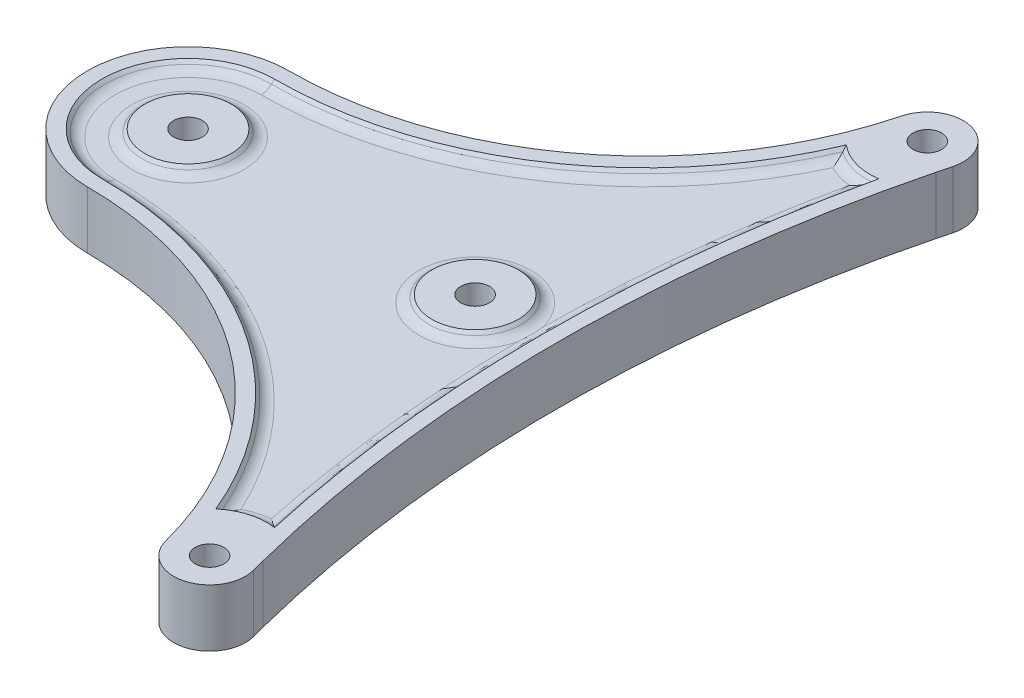
from build123d import *

# Parameters (mm, degrees)
BOSS_EXTRUDE1_DEPTH     = 4
SKETCH2_R               = 2
CUT_EXTRUDE1_DEPTH      = 58.567351858
SKETCH4_R               = 2
CUT_EXTRUDE2_DEPTH      = 58.567351858
BOSS_EXTRUDE2_DEPTH     = 4
SKETCH7_R               = 2
CUT_EXTRUDE3_DEPTH      = 85.777889694
BOSS_EXTRUDE3_DEPTH     = 4
SKETCH9_R               = 6
CUT_EXTRUDE4_DEPTH      = 1
CUT_EXTRUDE4_DRAFT      = -45
FILLET5_R               = 2
MIRROR2_COPY_1_SKETCH_R = 6
MIRROR2_COPY_1_DEPTH    = 1
MIRROR2_COPY_1_DRAFT    = -45
FILLET5_OF_MIRROR2_R    = 2


with BuildPart() as part:
    # Sketch1 → Boss-Extrude1 (new, symmetric)
    with BuildSketch(Plane(origin=(0, 0, 0), x_dir=(1, 0, 0), z_dir=(0, 1, 0))):
        with BuildLine():
            Line((-14.839112534, -1.258169259), (-1.839112534, -51.258169259))
            ThreePointArc((-1.839112534, -51.258169259), (4.258169259, -54.839112534), (7.839112534, -48.741830741))
            Line((7.839112534, -48.741830741), (-4.833763459, 0))
            Line((-4.833763459, 0), (-5.160887466, -1.258169259))
            ThreePointArc((-5.160887466, -1.258169259), (-10, -5), (-14.839112534, -1.258169259))
        make_face()
        with BuildLine():
            ThreePointArc((-14.839112534, 1.258169259), (-15, 0), (-14.839112534, -1.258169259))
            ThreePointArc((-14.839112534, -1.258169259), (-10, -5), (-5.160887466, -1.258169259))
            Line((-5.160887466, -1.258169259), (-4.833763459, 0))
            Line((-4.833763459, 0), (-5.160887466, 1.258169259))
            ThreePointArc((-5.160887466, 1.258169259), (-10, 5), (-14.839112534, 1.258169259))
        make_face()
        with BuildLine():
            Line((-1.839112534, 51.258169259), (-14.839112534, 1.258169259))
            ThreePointArc((-14.839112534, 1.258169259), (-10, 5), (-5.160887466, 1.258169259))
            Line((-5.160887466, 1.258169259), (-4.833763459, 0))
            Line((-4.833763459, 0), (7.839112534, 48.741830741))
            ThreePointArc((7.839112534, 48.741830741), (4.258169259, 54.839112534), (-1.839112534, 51.258169259))
        make_face()
    extrude(amount=BOSS_EXTRUDE1_DEPTH, both=True)

    # Sketch2 → Cut-Extrude1 (cut, through all)
    with BuildSketch(Plane(origin=(0, 4, 0), x_dir=(1, 0, 0), z_dir=(0, 1, 0))):
        with Locations(Location((-10, 0, 0), (0, 0, 270))):
            Circle(SKETCH2_R)
    extrude(amount=-CUT_EXTRUDE1_DEPTH, mode=Mode.SUBTRACT)

    # Sketch4 → Cut-Extrude2 (cut, through all)
    with BuildSketch(Plane(origin=(0, 4, 0), x_dir=(1, 0, 0), z_dir=(0, 1, 0))):
        with Locations(Location((3, -50, 0), (0, 0, 270))):
            Circle(SKETCH4_R)
        with Locations(Location((3, 50, 0), (0, 0, 270))):
            Circle(SKETCH4_R)
    extrude(amount=-CUT_EXTRUDE2_DEPTH, mode=Mode.SUBTRACT)

    # Sketch6 → Boss-Extrude2 (add, symmetric)
    with BuildSketch(Plane(origin=(0, 0, 0), x_dir=(1, 0, 0), z_dir=(0, 1, 0))):
        with BuildLine():
            Line((-1.839112534, -51.258169259), (-14.839112534, -1.258169259))
            ThreePointArc((-14.839112534, -1.258169259), (-15, 0), (-14.839112534, 1.258169259))
            Line((-14.839112534, 1.258169259), (-1.839112534, 51.258169259))
            ThreePointArc((-1.839112534, 51.258169259), (-19.560267402, 24.413897754), (-50, 14.017892663))
            ThreePointArc((-50, 14.017892663), (-64.017892663, 0), (-50, -14.017892663))
            ThreePointArc((-50, -14.017892663), (-19.560267402, -24.413897754), (-1.839112534, -51.258169259))
        make_face()
    extrude(amount=BOSS_EXTRUDE2_DEPTH, both=True)

    # Sketch7 → Cut-Extrude3 (cut, through all)
    with BuildSketch(Plane(origin=(0, 4, 0), x_dir=(1, 0, 0), z_dir=(0, 1, 0))):
        with Locations(Location((-50, 0, 0), (0, 0, 270))):
            Circle(SKETCH7_R)
    extrude(amount=-CUT_EXTRUDE3_DEPTH, mode=Mode.SUBTRACT)

    # Sketch8 → Boss-Extrude3 (add, symmetric)
    with BuildSketch(Plane(origin=(0, 0, 0), x_dir=(1, 0, 0), z_dir=(0, 1, 0))):
        with BuildLine():
            ThreePointArc((7.35446577, -46.877804725), (1.480703509, 0), (7.35446577, 46.877804725))
            Line((7.35446577, 46.877804725), (-4.833763459, 0))
            Line((-4.833763459, 0), (7.35446577, -46.877804725))
        make_face()
    extrude(amount=BOSS_EXTRUDE3_DEPTH, both=True)


with BuildPart() as cut_extrude4_tool:
    # Sketch9 → Cut-Extrude4 (with draft: the straight prism first)
    with BuildSketch(Plane(origin=(0, 4, 0), x_dir=(1, 0, 0), z_dir=(0, 1, 0))):
        with BuildLine():
            ThreePointArc((-2.199405253, -43.920017679), (0.776418175, -42.315230396), (4.149389552, -42.082999074))
            ThreePointArc((4.149389552, -42.082999074), (-0.519296491, 0), (4.149389552, 42.082999074))
            ThreePointArc((4.149389552, 42.082999074), (0.776418175, 42.315230396), (-2.199405253, 43.920017679))
            ThreePointArc((-2.199405253, 43.920017679), (-21.26568933, 20.725904419), (-50, 12.017892663))
            ThreePointArc((-50, 12.017892663), (-62.017892663, 0), (-50, -12.017892663))
            ThreePointArc((-50, -12.017892663), (-21.26568933, -20.725904419), (-2.199405253, -43.920017679))
        make_face()
        with Locations((-10, 0)):
            Circle(SKETCH9_R, mode=Mode.SUBTRACT)
        with Locations((-50, 0)):
            Circle(SKETCH9_R, mode=Mode.SUBTRACT)
    extrude(amount=-CUT_EXTRUDE4_DEPTH)
    # Cut-Extrude4: the draft: its side faces are tilted about the plane it starts from
    cut_extrude4_sides = [cut_extrude4_tool.faces().sort_by_distance(p)[0] for p in [
        (0.776418175, 3.5, 42.315230396),
        (-0.519296491, 3.5, 0),
        (0.776418175, 3.5, -42.315230396),
        (-21.26568933, 3.5, -20.725904419),
        (-62.017892663, 3.5, 0),
        (-21.26568933, 3.5, 20.725904419),
        (-16, 3.5, 0),
        (-56, 3.5, 0),
    ]]
    draft(cut_extrude4_sides, Plane(origin=(0, 4, 0), x_dir=(1, 0, 0), z_dir=(0, 1, 0)), CUT_EXTRUDE4_DRAFT)


with BuildPart() as part_1:
    add(part.part)

    # Cut-Extrude4: cut by cut_extrude4_tool
    add(cut_extrude4_tool.part, mode=Mode.SUBTRACT)

    # Fillet5
    # the kernel refuses this fillet: 2 mm, written as the material it adds along each edge
    with BuildSketch(Plane(origin=(-50, 3, 0), x_dir=(1, 0, 0), z_dir=(0, 0, 1))) as fillet5_piece_1:
        with BuildLine():
            CenterArc((7 + FILLET5_R * 0.414213562373, FILLET5_R), FILLET5_R, 225, 45)
            Line((7 - FILLET5_R * 0.292893218813, FILLET5_R * 0.292893218813), (7, 0))
            Line((7, 0), (7 + FILLET5_R * 0.414213562373, 0))
        make_face()
    fillet5_piece_1_solid = revolve(axis=Axis((-50, 3, 0), (0, 1, 0)), mode=Mode.PRIVATE)
    with BuildSketch(Plane(origin=(-10, 3, 0), x_dir=(1, 0, 0), z_dir=(0, 0, 1))) as fillet5_piece_2:
        with BuildLine():
            CenterArc((7 + FILLET5_R * 0.414213562373, FILLET5_R), FILLET5_R, 225, 45)
            Line((7 - FILLET5_R * 0.292893218813, FILLET5_R * 0.292893218813), (7, 0))
            Line((7, 0), (7 + FILLET5_R * 0.414213562373, 0))
        make_face()
    fillet5_piece_2_solid = revolve(axis=Axis((-10, 3, 0), (0, 1, 0)), mode=Mode.PRIVATE)
    with BuildSketch(Plane(origin=(-50, 3, 0), x_dir=(0, 0, -1), z_dir=(1, 0, 0))) as fillet5_piece_3:
        with BuildLine():
            CenterArc((11.017892663 - FILLET5_R * 0.414213562373, FILLET5_R), FILLET5_R, 270, 45)
            Line((11.017892663 - FILLET5_R * 0.414213562373, 0), (11.017892663, 0))
            Line((11.017892663, 0), (11.017892663 + FILLET5_R * 0.292893218813, FILLET5_R * 0.292893218813))
        make_face()
    fillet5_piece_3_solid = revolve(axis=Axis((-50, 3, 0), (0, 1, 0)), revolution_arc=180, mode=Mode.PRIVATE)
    with BuildSketch(Plane(origin=(-50, 3, -63.78), x_dir=(0.9292070128080167, 0, 0.369559639771989), z_dir=(0.369559639771989, 0, -0.9292070128080167))) as fillet5_piece_4:
        with BuildLine():
            CenterArc((52.762107337 + FILLET5_R * 0.414213562373, -FILLET5_R), FILLET5_R, 90, 45)
            Line((52.762107337 + FILLET5_R * 0.414213562373, 0), (52.762107337, 0))
            Line((52.762107337, 0), (52.762107337 - FILLET5_R * 0.292893218813, -FILLET5_R * 0.292893218813))
        make_face()
    fillet5_piece_4_solid = revolve(axis=Axis((-50, 3, -63.78), (0, -1, 0)), revolution_arc=68.311538304, mode=Mode.PRIVATE)
    with BuildSketch(Plane(origin=(3, 3, -50), x_dir=(0.21575905141921134, 0, 0.9764466353727079), z_dir=(0.9764466353727079, 0, -0.21575905141921134))) as fillet5_piece_5:
        with BuildLine():
            CenterArc((9 + FILLET5_R * 0.414213562373, -FILLET5_R), FILLET5_R, 90, 45)
            Line((9 + FILLET5_R * 0.414213562373, 0), (9, 0))
            Line((9, 0), (9 - FILLET5_R * 0.292893218813, -FILLET5_R * 0.292893218813))
        make_face()
    fillet5_piece_5_solid = revolve(axis=Axis((3, 3, -50), (0, -1, 0)), revolution_arc=57.697645728, mode=Mode.PRIVATE)
    with BuildSketch(Plane(origin=(191.480703509, 3, 0), x_dir=(-0.9748383813720877, 0, 0.2229128309538239), z_dir=(0.2229128309538239, 0, 0.9748383813720877))) as fillet5_piece_6:
        with BuildLine():
            CenterArc((193 + FILLET5_R * 0.414213562373, -FILLET5_R), FILLET5_R, 90, 45)
            Line((193 + FILLET5_R * 0.414213562373, 0), (193, 0))
            Line((193, 0), (193 - FILLET5_R * 0.292893218813, -FILLET5_R * 0.292893218813))
        make_face()
    fillet5_piece_6_solid = revolve(axis=Axis((191.480703509, 3, 0), (0, -1, 0)), revolution_arc=25.760350812, mode=Mode.PRIVATE)
    with BuildSketch(Plane(origin=(3, 3, 50), x_dir=(-0.7100327834858502, 0, -0.7041686206977245), z_dir=(-0.7041686206977245, 0, 0.7100327834858502))) as fillet5_piece_7:
        with BuildLine():
            CenterArc((9 + FILLET5_R * 0.414213562373, -FILLET5_R), FILLET5_R, 90, 45)
            Line((9 + FILLET5_R * 0.414213562373, 0), (9, 0))
            Line((9, 0), (9 - FILLET5_R * 0.292893218813, -FILLET5_R * 0.292893218813))
        make_face()
    fillet5_piece_7_solid = revolve(axis=Axis((3, 3, 50), (0, -1, 0)), revolution_arc=57.697645728, mode=Mode.PRIVATE)
    with BuildSketch(Plane(origin=(-50, 3, 63.78), x_dir=(0, 0, -1), z_dir=(-1, 0, 0))) as fillet5_piece_8:
        with BuildLine():
            CenterArc((52.762107337 + FILLET5_R * 0.414213562373, -FILLET5_R), FILLET5_R, 90, 45)
            Line((52.762107337 + FILLET5_R * 0.414213562373, 0), (52.762107337, 0))
            Line((52.762107337, 0), (52.762107337 - FILLET5_R * 0.292893218813, -FILLET5_R * 0.292893218813))
        make_face()
    fillet5_piece_8_solid = revolve(axis=Axis((-50, 3, 63.78), (0, -1, 0)), revolution_arc=68.311538304, mode=Mode.PRIVATE)
    add([fillet5_piece_1_solid, fillet5_piece_2_solid, fillet5_piece_3_solid, fillet5_piece_4_solid, fillet5_piece_5_solid, fillet5_piece_6_solid, fillet5_piece_7_solid, fillet5_piece_8_solid])


with BuildPart() as mirror2_copy_1_tool:
    # Mirror2 copy 1 sketch → Mirror2 copy 1 (with draft: the straight prism first)
    with BuildSketch(Plane.XZ.offset(4)):
        with BuildLine():
            ThreePointArc((-2.199405253, 43.920017679), (0.776418175, 42.315230396), (4.149389552, 42.082999074))
            ThreePointArc((4.149389552, 42.082999074), (-0.519296491, 0), (4.149389552, -42.082999074))
            ThreePointArc((4.149389552, -42.082999074), (0.776418175, -42.315230396), (-2.199405253, -43.920017679))
            ThreePointArc((-2.199405253, -43.920017679), (-21.26568933, -20.725904419), (-50, -12.017892663))
            ThreePointArc((-50, -12.017892663), (-62.017892663, 0), (-50, 12.017892663))
            ThreePointArc((-50, 12.017892663), (-21.26568933, 20.725904419), (-2.199405253, 43.920017679))
        make_face()
        with Locations((-10, 0)):
            Circle(MIRROR2_COPY_1_SKETCH_R, mode=Mode.SUBTRACT)
        with Locations((-50, 0)):
            Circle(MIRROR2_COPY_1_SKETCH_R, mode=Mode.SUBTRACT)
    extrude(amount=-MIRROR2_COPY_1_DEPTH)
    # Mirror2 copy 1: the draft: its side faces are tilted about the plane it starts from
    mirror2_copy_1_sides = [mirror2_copy_1_tool.faces().sort_by_distance(p)[0] for p in [
        (0.776418175, -3.5, 42.315230396),
        (-0.519296491, -3.5, 0),
        (0.776418175, -3.5, -42.315230396),
        (-21.26568933, -3.5, -20.725904419),
        (-62.017892663, -3.5, 0),
        (-21.26568933, -3.5, 20.725904419),
        (-16, -3.5, 0),
        (-56, -3.5, 0),
    ]]
    draft(mirror2_copy_1_sides, Plane.XZ.offset(4), MIRROR2_COPY_1_DRAFT)


with BuildPart() as part_2:
    add(part_1.part)

    # Mirror2 copy 1: cut by mirror2_copy_1_tool
    add(mirror2_copy_1_tool.part, mode=Mode.SUBTRACT)

    # Fillet5 of Mirror2
    # the kernel refuses this fillet: 2 mm, written as the material it adds along each edge
    with BuildSketch(Plane(origin=(-50, -3, 0), x_dir=(1, 0, 0), z_dir=(0, 0, -1))) as fillet5_of_mirror2_piece_1:
        with BuildLine():
            CenterArc((7 + FILLET5_OF_MIRROR2_R * 0.414213562373, FILLET5_OF_MIRROR2_R), FILLET5_OF_MIRROR2_R, 225, 45)
            Line((7 + FILLET5_OF_MIRROR2_R * 0.414213562373, 0), (7, 0))
            Line((7, 0), (7 - FILLET5_OF_MIRROR2_R * 0.292893218813, FILLET5_OF_MIRROR2_R * 0.292893218813))
        make_face()
    fillet5_of_mirror2_piece_1_solid = revolve(axis=Axis((-50, -3, 0), (0, -1, 0)), mode=Mode.PRIVATE)
    with BuildSketch(Plane(origin=(-10, -3, 0), x_dir=(1, 0, 0), z_dir=(0, 0, -1))) as fillet5_of_mirror2_piece_2:
        with BuildLine():
            CenterArc((7 + FILLET5_OF_MIRROR2_R * 0.414213562373, FILLET5_OF_MIRROR2_R), FILLET5_OF_MIRROR2_R, 225, 45)
            Line((7 - FILLET5_OF_MIRROR2_R * 0.292893218813, FILLET5_OF_MIRROR2_R * 0.292893218813), (7, 0))
            Line((7, 0), (7 + FILLET5_OF_MIRROR2_R * 0.414213562373, 0))
        make_face()
    fillet5_of_mirror2_piece_2_solid = revolve(axis=Axis((-10, -3, 0), (0, -1, 0)), mode=Mode.PRIVATE)
    with BuildSketch(Plane(origin=(-50, -3, 0), x_dir=(0, 0, -1), z_dir=(1, 0, 0))) as fillet5_of_mirror2_piece_3:
        with BuildLine():
            CenterArc((11.017892663 - FILLET5_OF_MIRROR2_R * 0.414213562373, -FILLET5_OF_MIRROR2_R), FILLET5_OF_MIRROR2_R, 45, 45)
            Line((11.017892663 + FILLET5_OF_MIRROR2_R * 0.292893218813, -FILLET5_OF_MIRROR2_R * 0.292893218813), (11.017892663, 0))
            Line((11.017892663, 0), (11.017892663 - FILLET5_OF_MIRROR2_R * 0.414213562373, 0))
        make_face()
    fillet5_of_mirror2_piece_3_solid = revolve(axis=Axis((-50, -3, 0), (0, 1, 0)), revolution_arc=180, mode=Mode.PRIVATE)
    with BuildSketch(Plane(origin=(-50, -3, -63.78), x_dir=(0.9292070128080167, 0, 0.369559639771989), z_dir=(0.369559639771989, 0, -0.9292070128080167))) as fillet5_of_mirror2_piece_4:
        with BuildLine():
            CenterArc((52.762107337 + FILLET5_OF_MIRROR2_R * 0.414213562373, FILLET5_OF_MIRROR2_R), FILLET5_OF_MIRROR2_R, 225, 45)
            Line((52.762107337 - FILLET5_OF_MIRROR2_R * 0.292893218813, FILLET5_OF_MIRROR2_R * 0.292893218813), (52.762107337, 0))
            Line((52.762107337, 0), (52.762107337 + FILLET5_OF_MIRROR2_R * 0.414213562373, 0))
        make_face()
    fillet5_of_mirror2_piece_4_solid = revolve(axis=Axis((-50, -3, -63.78), (0, -1, 0)), revolution_arc=68.311538304, mode=Mode.PRIVATE)
    with BuildSketch(Plane(origin=(3, -3, -50), x_dir=(0.21575905141921103, 0, 0.9764466353727079), z_dir=(0.9764466353727079, 0, -0.21575905141921103))) as fillet5_of_mirror2_piece_5:
        with BuildLine():
            CenterArc((9 + FILLET5_OF_MIRROR2_R * 0.414213562373, FILLET5_OF_MIRROR2_R), FILLET5_OF_MIRROR2_R, 225, 45)
            Line((9 - FILLET5_OF_MIRROR2_R * 0.292893218813, FILLET5_OF_MIRROR2_R * 0.292893218813), (9, 0))
            Line((9, 0), (9 + FILLET5_OF_MIRROR2_R * 0.414213562373, 0))
        make_face()
    fillet5_of_mirror2_piece_5_solid = revolve(axis=Axis((3, -3, -50), (0, -1, 0)), revolution_arc=57.697645728, mode=Mode.PRIVATE)
    with BuildSketch(Plane(origin=(191.480703509, -3, 0), x_dir=(-0.9748383813720877, 0, 0.2229128309538239), z_dir=(0.2229128309538239, 0, 0.9748383813720877))) as fillet5_of_mirror2_piece_6:
        with BuildLine():
            CenterArc((193 + FILLET5_OF_MIRROR2_R * 0.414213562373, FILLET5_OF_MIRROR2_R), FILLET5_OF_MIRROR2_R, 225, 45)
            Line((193 - FILLET5_OF_MIRROR2_R * 0.292893218813, FILLET5_OF_MIRROR2_R * 0.292893218813), (193, 0))
            Line((193, 0), (193 + FILLET5_OF_MIRROR2_R * 0.414213562373, 0))
        make_face()
    fillet5_of_mirror2_piece_6_solid = revolve(axis=Axis((191.480703509, -3, 0), (0, -1, 0)), revolution_arc=25.760350812, mode=Mode.PRIVATE)
    with BuildSketch(Plane(origin=(3, -3, 50), x_dir=(-0.7100327834858502, 0, -0.7041686206977245), z_dir=(-0.7041686206977245, 0, 0.7100327834858502))) as fillet5_of_mirror2_piece_7:
        with BuildLine():
            CenterArc((9 + FILLET5_OF_MIRROR2_R * 0.414213562373, FILLET5_OF_MIRROR2_R), FILLET5_OF_MIRROR2_R, 225, 45)
            Line((9 - FILLET5_OF_MIRROR2_R * 0.292893218813, FILLET5_OF_MIRROR2_R * 0.292893218813), (9, 0))
            Line((9, 0), (9 + FILLET5_OF_MIRROR2_R * 0.414213562373, 0))
        make_face()
    fillet5_of_mirror2_piece_7_solid = revolve(axis=Axis((3, -3, 50), (0, -1, 0)), revolution_arc=57.697645728, mode=Mode.PRIVATE)
    with BuildSketch(Plane(origin=(-50, -3, 63.78), x_dir=(0, 0, -1), z_dir=(-1, 0, 0))) as fillet5_of_mirror2_piece_8:
        with BuildLine():
            CenterArc((52.762107337 + FILLET5_OF_MIRROR2_R * 0.414213562373, FILLET5_OF_MIRROR2_R), FILLET5_OF_MIRROR2_R, 225, 45)
            Line((52.762107337 - FILLET5_OF_MIRROR2_R * 0.292893218813, FILLET5_OF_MIRROR2_R * 0.292893218813), (52.762107337, 0))
            Line((52.762107337, 0), (52.762107337 + FILLET5_OF_MIRROR2_R * 0.414213562373, 0))
        make_face()
    fillet5_of_mirror2_piece_8_solid = revolve(axis=Axis((-50, -3, 63.78), (0, -1, 0)), revolution_arc=68.311538304, mode=Mode.PRIVATE)
    add([fillet5_of_mirror2_piece_1_solid, fillet5_of_mirror2_piece_2_solid, fillet5_of_mirror2_piece_3_solid, fillet5_of_mirror2_piece_4_solid, fillet5_of_mirror2_piece_5_solid, fillet5_of_mirror2_piece_6_solid, fillet5_of_mirror2_piece_7_solid, fillet5_of_mirror2_piece_8_solid])


solid = part_2.part
